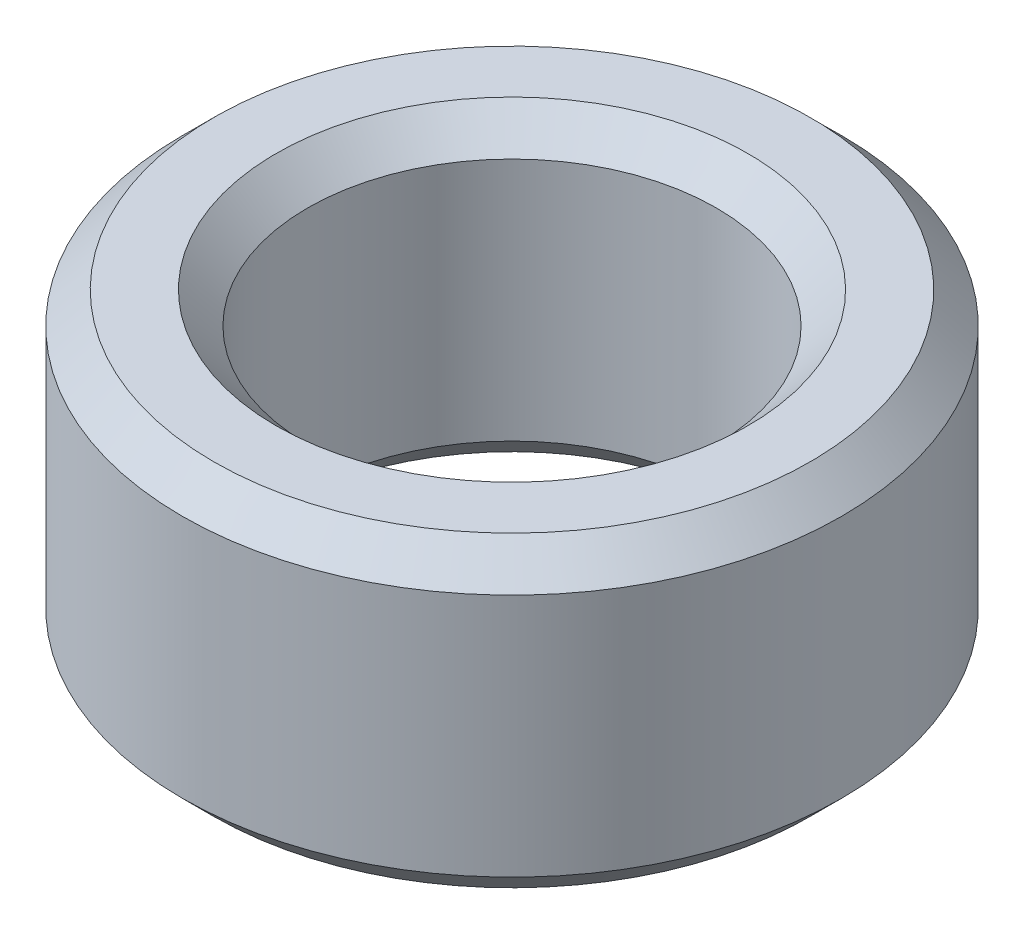
from build123d import *

# Parameters (mm, degrees)
SKETCH1_R           = 37.5
BOSS_EXTRUDE1_DEPTH = 34.93443132
SKETCH2_R           = 23.251448497
CUT_EXTRUDE1_DEPTH  = 64.505232002
CHAMFER1_SIZE       = 3.577959421


with BuildPart() as part:
    # Sketch1 → Boss-Extrude1 (new body)
    with BuildSketch(Plane(origin=(0, 0, 0), x_dir=(1, 0, 0), z_dir=(0, 1, 0))):
        Circle(SKETCH1_R)
    extrude(amount=BOSS_EXTRUDE1_DEPTH)

    # Sketch2 → Cut-Extrude1 (cut, through all)
    with BuildSketch(Plane(origin=(0, 0, 0), x_dir=(1, 0, 0), z_dir=(0, 1, 0))):
        Circle(SKETCH2_R)
    extrude(amount=CUT_EXTRUDE1_DEPTH, mode=Mode.SUBTRACT)

    # Chamfer1
    chamfer1_edges = [part.edges().sort_by_distance(p)[0] for p in [
        (-23.251448497, 34.93443132, 0),
        (-23.251448497, 0, 0),
        (-37.5, 0, 0),
        (-37.5, 34.93443132, 0),
    ]]
    chamfer(chamfer1_edges, length=CHAMFER1_SIZE)


solid = part.part
